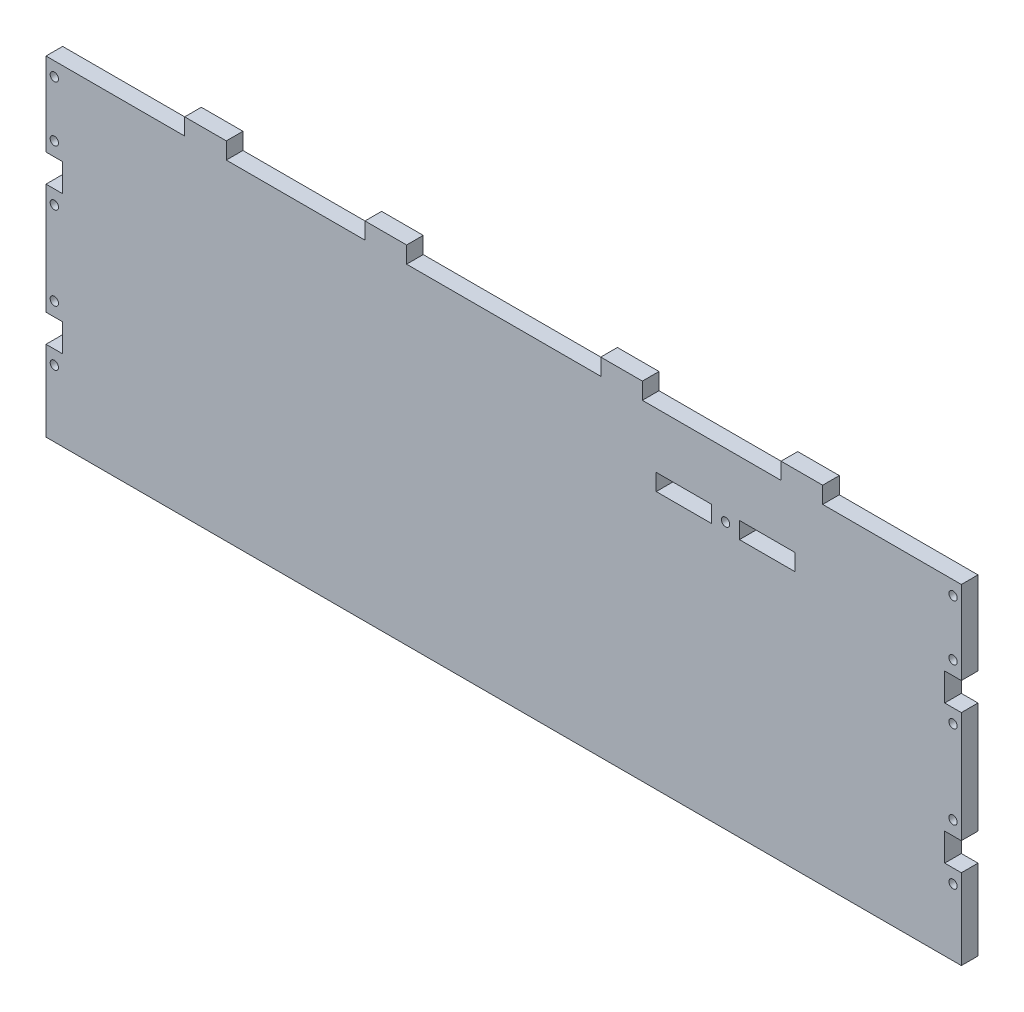
from build123d import *

# Parameters (mm, degrees)
ESQUISSE1_W             = 330
ESQUISSE1_H             = 238
ESQUISSE1_W_2           = 15
ESQUISSE1_H_2           = 6
ESQUISSE1_W_3           = 20
BOSS_EXTRU_1_DEPTH      = 6
ESQUISSE2_W             = 15
ESQUISSE2_H             = 6
BOSS_EXTRU_2_DEPTH      = 6
ESQUISSE3_W             = 6
ESQUISSE3_H             = 10
ESQUISSE3_W_2           = 12
ENL_V_MAT_EXTRU_1_DEPTH = 6
ESQUISSE4_R             = 1.5
ENL_V_MAT_EXTRU_2_DEPTH = 6
ESQUISSE5_W             = 423.604058921
ESQUISSE5_H             = 150.356061945
ENL_V_MAT_EXTRU_3_DEPTH = 6


with BuildPart() as part:
    # Esquisse1 → Boss.-Extru.1 (new body)
    with BuildSketch(Plane.XY):
        Rectangle(ESQUISSE1_W, ESQUISSE1_H)
        with Locations((-85, -58)):
            Rectangle(ESQUISSE1_W_2, ESQUISSE1_H_2, mode=Mode.SUBTRACT)
        with Locations((0, -58)):
            Rectangle(ESQUISSE1_W_2, ESQUISSE1_H_2, mode=Mode.SUBTRACT)
        with Locations((85, -58)):
            Rectangle(ESQUISSE1_W_2, ESQUISSE1_H_2, mode=Mode.SUBTRACT)
        with Locations((65, 96)):
            Rectangle(ESQUISSE1_W_3, ESQUISSE1_H_2, mode=Mode.SUBTRACT)
        with Locations((95, 96)):
            Rectangle(ESQUISSE1_W_3, ESQUISSE1_H_2, mode=Mode.SUBTRACT)
    extrude(amount=BOSS_EXTRU_1_DEPTH)

    # Esquisse2 → Boss.-Extru.2 (add)
    with BuildSketch(Plane.XY.offset(6)):
        with Locations((-107.5, 122)):
            Rectangle(ESQUISSE2_W, ESQUISSE2_H)
        with Locations((107.5, 122)):
            Rectangle(ESQUISSE2_W, ESQUISSE2_H)
        with Locations((42.5, 122)):
            Rectangle(ESQUISSE2_W, ESQUISSE2_H)
        with Locations((-42.5, 122)):
            Rectangle(ESQUISSE2_W, ESQUISSE2_H)
        with Locations((107.5, -122)):
            Rectangle(ESQUISSE2_W, ESQUISSE2_H)
        with Locations((-107.5, -122)):
            Rectangle(ESQUISSE2_W, ESQUISSE2_H)
        with Locations((-42.5, -122)):
            Rectangle(ESQUISSE2_W, ESQUISSE2_H)
        with Locations((42.5, -122)):
            Rectangle(ESQUISSE2_W, ESQUISSE2_H)
    extrude(amount=-BOSS_EXTRU_2_DEPTH)

    # Esquisse3 → Enlèv. mat.-Extru.1 (cut)
    with BuildSketch(Plane.XY.offset(6)):
        with Locations((-162, 84)):
            Rectangle(ESQUISSE3_W, ESQUISSE3_H)
        with Locations((-162, 34)):
            Rectangle(ESQUISSE3_W, ESQUISSE3_H)
        with Locations((-162, -34)):
            Rectangle(ESQUISSE3_W, ESQUISSE3_H)
        with Locations((-162, -84)):
            Rectangle(ESQUISSE3_W, ESQUISSE3_H)
        with Locations((162, -84)):
            Rectangle(ESQUISSE3_W, ESQUISSE3_H)
        with Locations((162, -34)):
            Rectangle(ESQUISSE3_W, ESQUISSE3_H)
        with Locations((162, 34)):
            Rectangle(ESQUISSE3_W, ESQUISSE3_H)
        with Locations((162, 84)):
            Rectangle(ESQUISSE3_W, ESQUISSE3_H)
        with Locations((159, -114)):
            Rectangle(ESQUISSE3_W_2, ESQUISSE3_H)
        with Locations((-159, -114)):
            Rectangle(ESQUISSE3_W_2, ESQUISSE3_H)
    extrude(amount=-ENL_V_MAT_EXTRU_1_DEPTH, mode=Mode.SUBTRACT)

    # Esquisse4 → Enlèv. mat.-Extru.2 (cut)
    with BuildSketch(Plane.XY.offset(6)):
        with Locations((-162, 114)):
            Circle(ESQUISSE4_R)
        with Locations((-162, 94)):
            Circle(ESQUISSE4_R)
        with Locations((-162, 74)):
            Circle(ESQUISSE4_R)
        with Locations((-162, 44)):
            Circle(ESQUISSE4_R)
        with Locations((-162, 24)):
            Circle(ESQUISSE4_R)
        with Locations((-162, -24)):
            Circle(ESQUISSE4_R)
        with Locations((-162, -44)):
            Circle(ESQUISSE4_R)
        with Locations((-162, -74)):
            Circle(ESQUISSE4_R)
        with Locations((-162, -94)):
            Circle(ESQUISSE4_R)
        with Locations((-97.5, -58)):
            Circle(ESQUISSE4_R)
        with Locations((-72.5, -58)):
            Circle(ESQUISSE4_R)
        with Locations((162, -94)):
            Circle(ESQUISSE4_R)
        with Locations((162, -74)):
            Circle(ESQUISSE4_R)
        with Locations((162, -44)):
            Circle(ESQUISSE4_R)
        with Locations((162, -24)):
            Circle(ESQUISSE4_R)
        with Locations((80, 96)):
            Circle(ESQUISSE4_R)
        with Locations((162, 24)):
            Circle(ESQUISSE4_R)
        with Locations((162, 44)):
            Circle(ESQUISSE4_R)
        with Locations((162, 74)):
            Circle(ESQUISSE4_R)
        with Locations((162, 94)):
            Circle(ESQUISSE4_R)
        with Locations((162, 114)):
            Circle(ESQUISSE4_R)
        with Locations((-12.5, -58)):
            Circle(ESQUISSE4_R)
        with Locations((12.5, -58)):
            Circle(ESQUISSE4_R)
        with Locations((72.5, -58)):
            Circle(ESQUISSE4_R)
        with Locations((97.5, -58)):
            Circle(ESQUISSE4_R)
    extrude(amount=-ENL_V_MAT_EXTRU_2_DEPTH, mode=Mode.SUBTRACT)

    # Esquisse5 → Enlèv. mat.-Extru.3 (cut)
    with BuildSketch(Plane.XY.offset(6)):
        with Locations((11.705214191, -75.178030973)):
            Rectangle(ESQUISSE5_W, ESQUISSE5_H)
    extrude(amount=-ENL_V_MAT_EXTRU_3_DEPTH, mode=Mode.SUBTRACT)


solid = part.part
